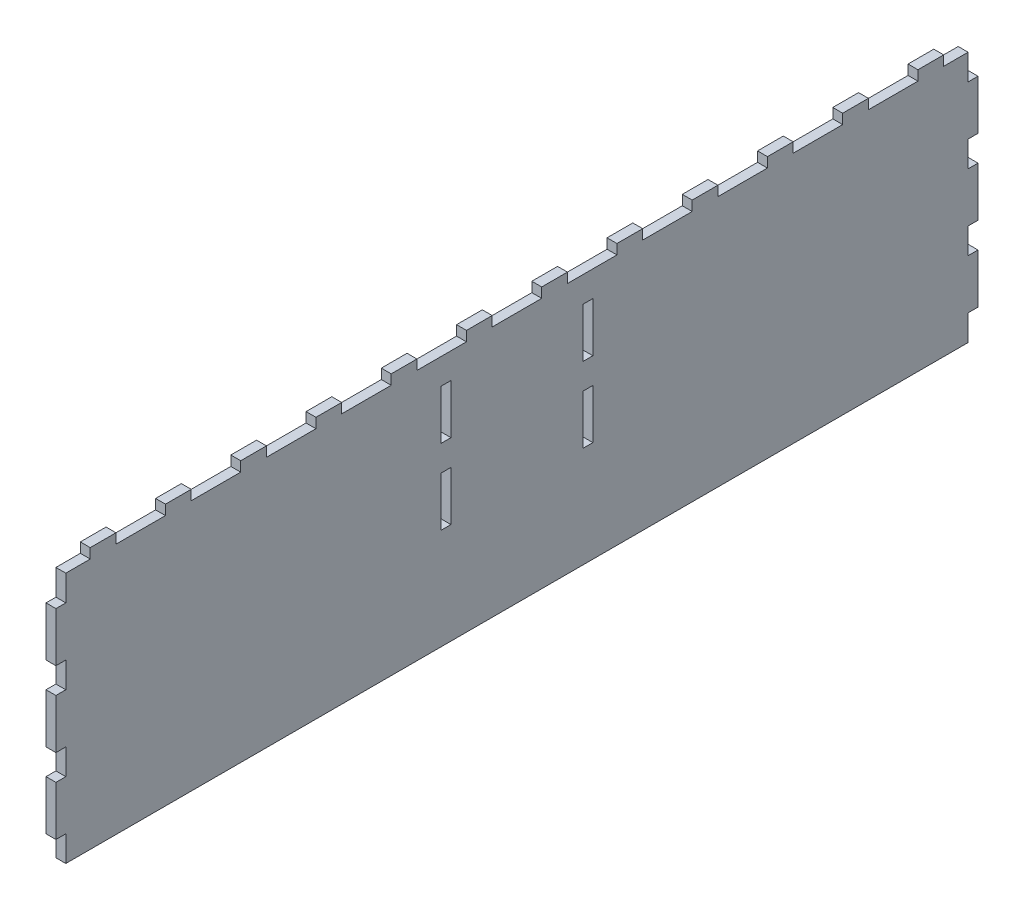
from build123d import *

# Parameters (mm, degrees)
SKETCH1_W               = 279.4
SKETCH1_H               = 76.2
BOSS_EXTRUDE1_DEPTH     = 3
SKETCH3_W               = 3
SKETCH3_H               = 7.8
CUT_EXTRUDE1_DEPTH      = 145.833352512
LPATTERN1_COUNT         = 4
LPATTERN1_PITCH         = 22.8
MIRROR1_COPY_1_SKETCH_W = 3
MIRROR1_COPY_1_SKETCH_H = 7.8
MIRROR1_COPY_1_DEPTH    = 145.833352512
MIRROR1_COPY_2_SKETCH_W = 3
MIRROR1_COPY_2_SKETCH_H = 7.8
MIRROR1_COPY_2_DEPTH    = 145.833352512
MIRROR1_COPY_3_SKETCH_W = 3
MIRROR1_COPY_3_SKETCH_H = 7.8
MIRROR1_COPY_3_DEPTH    = 145.833352512
MIRROR1_COPY_4_SKETCH_W = 3
MIRROR1_COPY_4_SKETCH_H = 7.8
MIRROR1_COPY_4_DEPTH    = 145.833352512
SKETCH5_W               = 3
SKETCH5_H               = 15
CUT_EXTRUDE3_DEPTH      = 10
SKETCH9_W               = 3
SKETCH9_H               = 7.8
BOSS_EXTRUDE2_DEPTH     = 3
LPATTERN4_COUNT         = 12
LPATTERN4_PITCH         = 22.8
LPATTERN5_COUNT         = 2
LPATTERN5_PITCH         = 22.8
MIRROR2_COPY_1_SKETCH_W = 3
MIRROR2_COPY_1_SKETCH_H = 15
MIRROR2_COPY_1_DEPTH    = 10
MIRROR2_COPY_2_SKETCH_W = 3
MIRROR2_COPY_2_SKETCH_H = 15
MIRROR2_COPY_2_DEPTH    = 10


with BuildPart() as part:
    # Sketch1 → Boss-Extrude1 (new body)
    with BuildSketch(Plane(origin=(0, 0, 0), x_dir=(0, 0, -1), z_dir=(1, 0, 0))):
        Rectangle(SKETCH1_W, SKETCH1_H)
    extrude(amount=-BOSS_EXTRUDE1_DEPTH)

    # Sketch3 → Cut-Extrude1 (cut, through all)
    with BuildSketch(Plane.ZY.offset(3)):
        with Locations((-138.2, 34.2)):
            Rectangle(SKETCH3_W, SKETCH3_H)
    cut_extrude1 = extrude(amount=-CUT_EXTRUDE1_DEPTH, mode=Mode.SUBTRACT)

    # LPattern1: Cut-Extrude1 ×4
    with Locations(*[(0, -i * LPATTERN1_PITCH, 0) for i in range(1, LPATTERN1_COUNT)]):
        add(cut_extrude1, mode=Mode.SUBTRACT)

    # Mirror1 copy 1 sketch → Mirror1 copy 1 (cut, through all)
    with BuildSketch(Plane(origin=(-3, -22.8, 0), x_dir=(0, 0, -1), z_dir=(-1, 0, 0))):
        with Locations((-138.2, -34.2)):
            Rectangle(MIRROR1_COPY_1_SKETCH_W, MIRROR1_COPY_1_SKETCH_H)
    extrude(amount=-MIRROR1_COPY_1_DEPTH, mode=Mode.SUBTRACT)

    # Mirror1 copy 2 sketch → Mirror1 copy 2 (cut, through all)
    with BuildSketch(Plane(origin=(-3, -45.6, 0), x_dir=(0, 0, -1), z_dir=(-1, 0, 0))):
        with Locations((-138.2, -34.2)):
            Rectangle(MIRROR1_COPY_2_SKETCH_W, MIRROR1_COPY_2_SKETCH_H)
    extrude(amount=-MIRROR1_COPY_2_DEPTH, mode=Mode.SUBTRACT)

    # Mirror1 copy 3 sketch → Mirror1 copy 3 (cut, through all)
    with BuildSketch(Plane(origin=(-3, -68.4, 0), x_dir=(0, 0, -1), z_dir=(-1, 0, 0))):
        with Locations((-138.2, -34.2)):
            Rectangle(MIRROR1_COPY_3_SKETCH_W, MIRROR1_COPY_3_SKETCH_H)
    extrude(amount=-MIRROR1_COPY_3_DEPTH, mode=Mode.SUBTRACT)

    # Mirror1 copy 4 sketch → Mirror1 copy 4 (cut, through all)
    with BuildSketch(Plane(origin=(-3, 0, 0), x_dir=(0, 0, -1), z_dir=(-1, 0, 0))):
        with Locations((-138.2, -34.2)):
            Rectangle(MIRROR1_COPY_4_SKETCH_W, MIRROR1_COPY_4_SKETCH_H)
    extrude(amount=-MIRROR1_COPY_4_DEPTH, mode=Mode.SUBTRACT)

    # Sketch5 → Cut-Extrude3 (cut)
    with BuildSketch(Plane.ZY.offset(3)):
        with Locations((-21.5, 22.8)):
            Rectangle(SKETCH5_W, SKETCH5_H)
    cut_extrude3 = extrude(amount=-CUT_EXTRUDE3_DEPTH, mode=Mode.SUBTRACT)

    # Sketch9 → Boss-Extrude2 (add)
    with BuildSketch(Plane(origin=(0, 38.1, 0), x_dir=(1, 0, 0), z_dir=(0, 1, 0))):
        with Locations((-1.5, 125.4)):
            Rectangle(SKETCH9_W, SKETCH9_H)
    boss_extrude2 = extrude(amount=BOSS_EXTRUDE2_DEPTH)

    # LPattern4: Boss-Extrude2 ×12
    with Locations(*[(0, 0, i * LPATTERN4_PITCH) for i in range(1, LPATTERN4_COUNT)]):
        add(boss_extrude2)

    # LPattern5: Cut-Extrude3 ×2
    with Locations(*[(0, -i * LPATTERN5_PITCH, 0) for i in range(1, LPATTERN5_COUNT)]):
        add(cut_extrude3, mode=Mode.SUBTRACT)

    # Mirror2 copy 1 sketch → Mirror2 copy 1 (cut)
    with BuildSketch(Plane(origin=(-3, -22.8, 0), x_dir=(0, 0, -1), z_dir=(-1, 0, 0))):
        with Locations((-21.5, -22.8)):
            Rectangle(MIRROR2_COPY_1_SKETCH_W, MIRROR2_COPY_1_SKETCH_H)
    extrude(amount=-MIRROR2_COPY_1_DEPTH, mode=Mode.SUBTRACT)

    # Mirror2 copy 2 sketch → Mirror2 copy 2 (cut)
    with BuildSketch(Plane(origin=(-3, 0, 0), x_dir=(0, 0, -1), z_dir=(-1, 0, 0))):
        with Locations((-21.5, -22.8)):
            Rectangle(MIRROR2_COPY_2_SKETCH_W, MIRROR2_COPY_2_SKETCH_H)
    extrude(amount=-MIRROR2_COPY_2_DEPTH, mode=Mode.SUBTRACT)


solid = part.part
